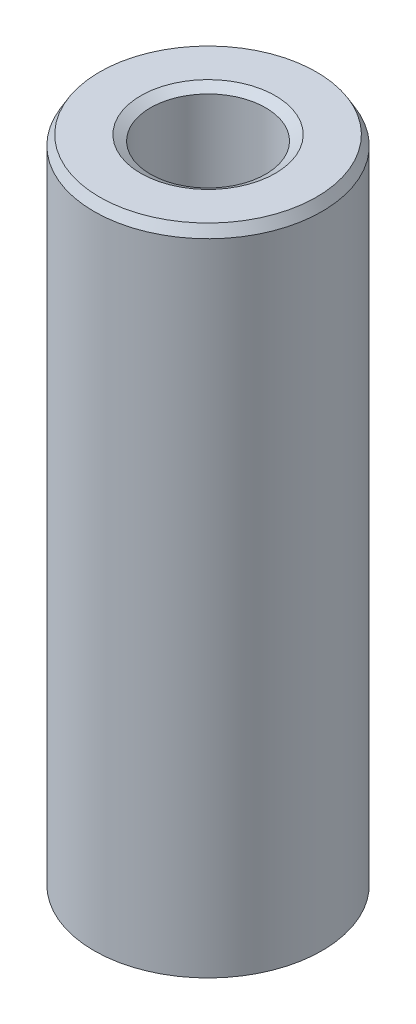
from build123d import *
from OCP.BRepFilletAPI import BRepFilletAPI_MakeChamfer

# Parameters (mm, degrees)
SKETCH1_R           = 10
BOSS_EXTRUDE1_DEPTH = 57.488261041
SKETCH2_R           = 5.054424798
CUT_EXTRUDE1_DEPTH  = 60.202197236
CHAMFER1_SIZE       = 0.84782278
CHAMFER1_SIZE2      = 0.48949071


with BuildPart() as part:
    # Sketch1 → Boss-Extrude1 (new body)
    with BuildSketch(Plane(origin=(0, 0, 0), x_dir=(1, 0, 0), z_dir=(0, 1, 0))):
        Circle(SKETCH1_R)
    extrude(amount=BOSS_EXTRUDE1_DEPTH)

    # Sketch2 → Cut-Extrude1 (cut, through all)
    with BuildSketch(Plane(origin=(0, 0, 0), x_dir=(1, 0, 0), z_dir=(0, 1, 0))):
        Circle(SKETCH2_R)
    extrude(amount=CUT_EXTRUDE1_DEPTH, mode=Mode.SUBTRACT)

    # Chamfer1: one chamfer whose edges measure the first distance from different faces: ONE call of the kernel's chamfer builder (chamfer() names one face for all edges)
    chamfer1_edges_1 = [part.edges().sort_by_distance(p)[0] for p in [
        (-5.054424798, 57.488261041, 0),
    ]]
    chamfer1_side_1 = [part.faces().sort_by_distance(p)[0] for p in [
        (-9.717157288, 57.488261041, 0),
    ]]
    chamfer1_edges_2 = [part.edges().sort_by_distance(p)[0] for p in [
        (-5.054424798, 0, 0),
    ]]
    chamfer1_side_2 = [part.faces().sort_by_distance(p)[0] for p in [
        (-5.054424798, 28.744130521, 0),
    ]]
    chamfer1_edges_3 = [part.edges().sort_by_distance(p)[0] for p in [
        (-10, 0, 0),
    ]]
    chamfer1_side_3 = [part.faces().sort_by_distance(p)[0] for p in [
        (-9.717157288, 0, 0),
    ]]
    chamfer1_edges_4 = [part.edges().sort_by_distance(p)[0] for p in [
        (-10, 57.488261041, 0),
    ]]
    chamfer1_side_4 = [part.faces().sort_by_distance(p)[0] for p in [
        (-10, 28.744130521, 0),
    ]]
    chamfer1 = BRepFilletAPI_MakeChamfer(part.part.solid().wrapped)
    for e in chamfer1_edges_1:
        chamfer1.Add(CHAMFER1_SIZE, CHAMFER1_SIZE2, e.wrapped, chamfer1_side_1[0].wrapped)  # the first distance lies on this face
    for e in chamfer1_edges_2:
        chamfer1.Add(CHAMFER1_SIZE, CHAMFER1_SIZE2, e.wrapped, chamfer1_side_2[0].wrapped)  # the first distance lies on this face
    for e in chamfer1_edges_3:
        chamfer1.Add(CHAMFER1_SIZE, CHAMFER1_SIZE2, e.wrapped, chamfer1_side_3[0].wrapped)  # the first distance lies on this face
    for e in chamfer1_edges_4:
        chamfer1.Add(CHAMFER1_SIZE, CHAMFER1_SIZE2, e.wrapped, chamfer1_side_4[0].wrapped)  # the first distance lies on this face
    add(Compound.cast(chamfer1.Shape()), mode=Mode.REPLACE)


solid = part.part
